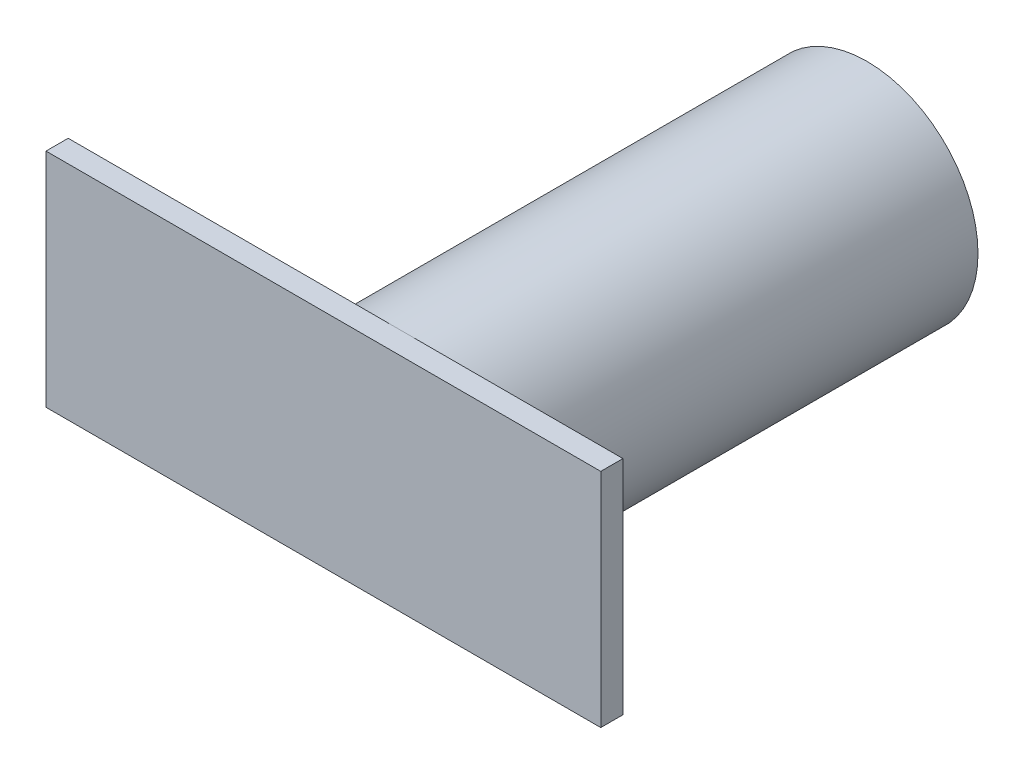
from build123d import *

# Parameters (mm, degrees)
SKETCH4_W           = 5
SKETCH4_H           = 2
BOSS_EXTRUDE3_DEPTH = 0.2
SKETCH6_R           = 1
BOSS_EXTRUDE4_DEPTH = 4.2
SKETCH7_R           = 0.75
CUT_EXTRUDE2_DEPTH  = 4.2


with BuildPart() as part:
    # Sketch4 → Boss-Extrude3 (new body)
    with BuildSketch(Plane.XY.offset(5)):
        with Locations((-0.5, 0)):
            Rectangle(SKETCH4_W, SKETCH4_H)
    extrude(amount=BOSS_EXTRUDE3_DEPTH)

    # Sketch6 → Boss-Extrude4 (add)
    with BuildSketch(Plane.XY.offset(5)):
        Circle(SKETCH6_R)
    extrude(amount=-BOSS_EXTRUDE4_DEPTH)

    # Sketch7 → Cut-Extrude2 (cut)
    with BuildSketch(Plane.XY.offset(5)):
        Circle(SKETCH7_R)
    extrude(amount=-CUT_EXTRUDE2_DEPTH, mode=Mode.SUBTRACT)


solid = part.part
